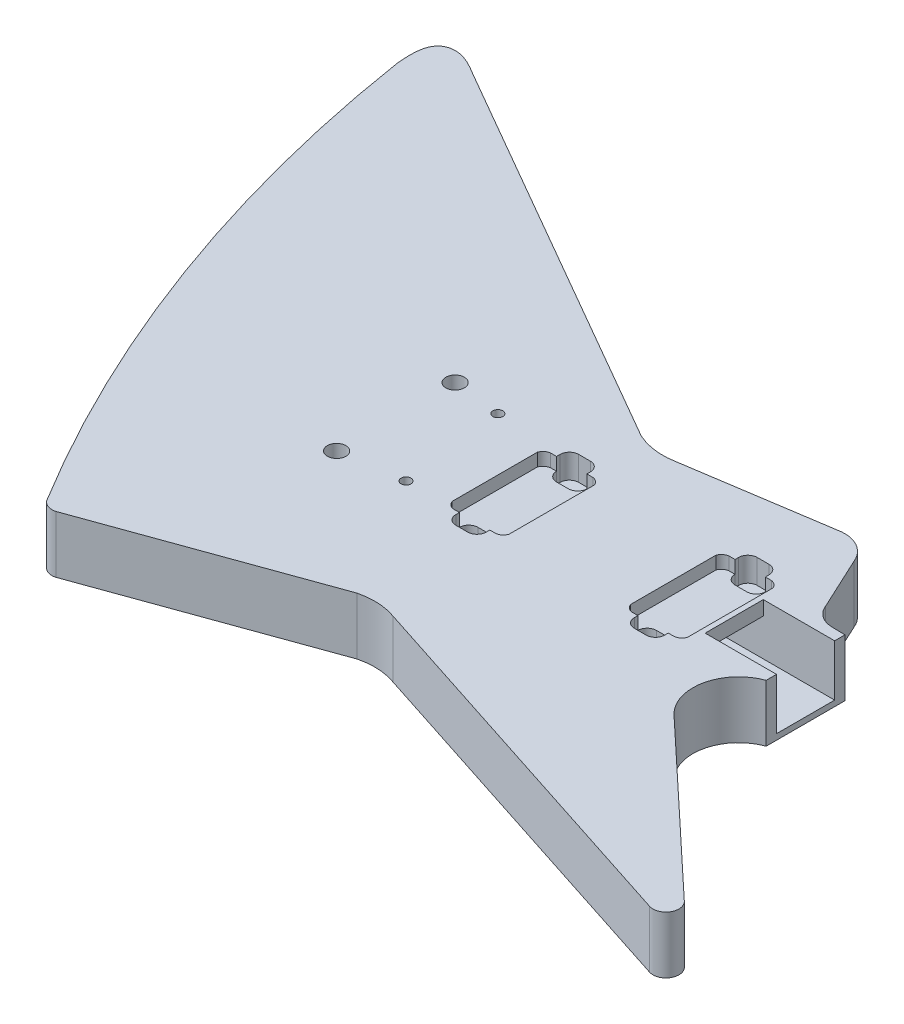
from build123d import *
from OCP.BRepAlgoAPI import BRepAlgoAPI_Cut
from OCP.TopTools import TopTools_ListOfShape
from build123d.topology import SkipClean

# Parameters (mm, degrees)
BOSS_EXTRUDE1_DEPTH            = 40
CUT_EXTRUDE1_DEPTH             = 9
CUT_EXTRUDE2_DEPTH             = 8
CUT_EXTRUDE3_DEPTH             = 9
CUT_EXTRUDE4_DEPTH             = 8
CUT_EXTRUDE5_DEPTH             = 8
CUT_EXTRUDE6_DEPTH             = 8
CUT_EXTRUDE7_DEPTH             = 40.73
F_7_0_7_DIAMETER_HOLE1_D       = 7
F_7_0_7_DIAMETER_HOLE1_DEPTH   = 29
F_13_0_13_DIAMETER_HOLE1_D     = 13
F_13_0_13_DIAMETER_HOLE1_DEPTH = 29


with BuildPart() as part:
    # Sketch1 → Boss-Extrude1 (new body)
    with BuildSketch(Plane(origin=(0, 20, 0), x_dir=(1, 0, 0), z_dir=(0, 1, 0))):
        with BuildLine():
            Line((563.96485174, 507.513718698), (563.96485174, 562.736423486))
            Line((563.96485174, 562.736423486), (554.690781869, 562.894803628))
            ThreePointArc((554.690781869, 562.894803628), (545.704943994, 565.795150829), (539.853906856, 573.206133263))
            Line((539.853906856, 573.206133263), (522.524343645, 610.429990226))
            ThreePointArc((522.524343645, 610.429990226), (512.649800976, 621.543175495), (497.931198247, 623.634159339))
            Line((497.931198247, 623.634159339), (399.830947056, 608.608698386))
            ThreePointArc((399.830947056, 608.608698386), (385.610832142, 608.137408426), (371.923585817, 612.02238853))
            Line((371.923585817, 612.02238853), (95.310746964, 771.494097008))
            add(Edge.make_bspline(
                [(60.287007155, 752.902507236), (59.408683029, 762.769524202), (58.560960325, 776.204376236), (76.94287295, 783.298520304), (86.753146937, 776.493697586), (95.310746964, 771.494097008)],
                knots=[0, 0, 0, 0, 0.5, 0.5, 1, 1, 1, 1], degree=3))
            ThreePointArc((60.287007155, 752.902507236), (112.407005996, 551.803928099), (202.762947005, 364.739937083))
            ThreePointArc((202.762947005, 364.739937083), (207.132055784, 361.391783138), (212.632195034, 361.173346422))
            Line((212.632195034, 361.173346422), (367.65464082, 417.084401042))
            ThreePointArc((367.65464082, 417.084401042), (380.966681082, 418.419109504), (394.090964942, 415.82198883))
            Line((394.090964942, 415.82198883), (660.231475403, 329.574923038))
            ThreePointArc((660.231475403, 329.574923038), (670.878462163, 333.606992627), (669.266978502, 344.877264703))
            Line((669.266978502, 344.877264703), (553.73117364, 453.239940989))
            ThreePointArc((553.73117364, 453.239940989), (543.342125743, 483.300566911), (563.96485174, 507.513718698))
        make_face()
    extrude(amount=-BOSS_EXTRUDE1_DEPTH)

    # Sketch2 → Cut-Extrude1 (cut)
    with BuildSketch(Plane(origin=(0, 20, 0), x_dir=(-1, 0, 0), z_dir=(0, 1, 0))):
        with BuildLine():
            Line((-375.961047941, -499.395283579), (-375.961047941, -501.895283579))
            Line((-375.961047941, -501.895283579), (-380.19743869, -501.895283579))
            ThreePointArc((-380.19743869, -501.895283579), (-383.334721276, -503.261242071), (-385.264615119, -506.086820662))
            Line((-385.264615119, -506.086820662), (-385.264615119, -565.732528297))
            ThreePointArc((-385.264615119, -565.732528297), (-383.334721277, -568.558106887), (-380.197438694, -569.924065379))
            Line((-380.197438694, -569.924065379), (-375.961047941, -569.924065379))
            Line((-375.961047941, -569.924065379), (-375.961047941, -572.424065379))
            ThreePointArc((-375.961047941, -572.424065379), (-374.057242019, -577.020259457), (-369.461047941, -578.924065379))
            Line((-369.461047941, -578.924065379), (-361.195765613, -578.924065379))
            ThreePointArc((-361.195765613, -578.924065379), (-356.599571535, -577.020259457), (-354.695765613, -572.424065379))
            Line((-354.695765613, -572.424065379), (-354.695765613, -569.924065379))
            Line((-354.695765613, -569.924065379), (-350.459374862, -569.924065379))
            ThreePointArc((-350.459374862, -569.924065379), (-347.322092956, -568.55810734), (-345.3922012, -565.732528296))
            Line((-345.3922012, -565.732528296), (-345.3922012, -506.086820663))
            ThreePointArc((-345.3922012, -506.086820663), (-347.322092957, -503.261241618), (-350.459374866, -501.895283579))
            Line((-350.459374866, -501.895283579), (-354.695765613, -501.895283579))
            Line((-354.695765613, -501.895283579), (-354.695765613, -499.395283579))
            ThreePointArc((-354.695765613, -499.395283579), (-356.599571535, -494.799089501), (-361.195765613, -492.895283579))
            Line((-361.195765613, -492.895283579), (-369.461047941, -492.895283579))
            ThreePointArc((-369.461047941, -492.895283579), (-374.057242019, -494.799089501), (-375.961047941, -499.395283579))
        make_face()
    extrude(amount=-CUT_EXTRUDE1_DEPTH, mode=Mode.SUBTRACT)

    # Sketch3 → Cut-Extrude2 (cut)
    with BuildSketch(Plane(origin=(0, 11, 0), x_dir=(-1, 0, 0), z_dir=(0, 1, 0))):
        with BuildLine():
            Line((-361.195765613, -492.895279984), (-369.461047941, -492.895279984))
            ThreePointArc((-369.461047941, -492.895279984), (-374.057242019, -494.799085907), (-375.961047941, -499.395279985))
            Line((-375.961047941, -499.395279985), (-375.961047941, -501.895279985))
            ThreePointArc((-375.961047941, -501.895279985), (-374.057242221, -506.491473573), (-369.461048632, -508.395279293))
            Line((-369.461048632, -508.395279293), (-361.19104863, -508.395279293))
            ThreePointArc((-361.19104863, -508.395279293), (-356.596520928, -506.491186012), (-354.695765613, -501.895276389))
            Line((-354.695765613, -501.895276389), (-354.695765613, -499.395279984))
            ThreePointArc((-354.695765613, -499.395279984), (-356.599571535, -494.799085907), (-361.195765613, -492.895279984))
        make_face()
    extrude(amount=-CUT_EXTRUDE2_DEPTH, mode=Mode.SUBTRACT)

    # Sketch4 → Cut-Extrude3 (cut)
    with BuildSketch(Plane(origin=(0, 20, 0), x_dir=(-1, 0, 0), z_dir=(0, 1, 0))):
        with BuildLine():
            Line((-479.744131485, -572.424065379), (-479.744131485, -569.924065379))
            Line((-479.744131485, -569.924065379), (-475.507740734, -569.924065379))
            ThreePointArc((-475.507740734, -569.924065379), (-472.370458828, -568.55810734), (-470.440567072, -565.732528296))
            Line((-470.440567072, -565.732528296), (-470.440567072, -506.086820663))
            ThreePointArc((-470.440567072, -506.086820663), (-472.370458829, -503.261241618), (-475.507740738, -501.895283579))
            Line((-475.507740738, -501.895283579), (-479.744131485, -501.895283579))
            Line((-479.744131485, -501.895283579), (-479.744131485, -499.395283579))
            ThreePointArc((-479.744131485, -499.395283579), (-481.647937407, -494.799089501), (-486.244131485, -492.895283579))
            Line((-486.244131485, -492.895283579), (-494.509413812, -492.895283579))
            ThreePointArc((-494.509413812, -492.895283579), (-499.10560789, -494.799089501), (-501.009413812, -499.395283579))
            Line((-501.009413812, -499.395283579), (-501.009413812, -501.895283579))
            Line((-501.009413812, -501.895283579), (-505.245804562, -501.895283579))
            ThreePointArc((-505.245804562, -501.895283579), (-508.383087148, -503.261242071), (-510.312980991, -506.086820662))
            Line((-510.312980991, -506.086820662), (-510.312980991, -565.732528297))
            ThreePointArc((-510.312980991, -565.732528297), (-508.383087149, -568.558106887), (-505.245804566, -569.924065379))
            Line((-505.245804566, -569.924065379), (-501.009413812, -569.924065379))
            Line((-501.009413812, -569.924065379), (-501.009413812, -572.424065379))
            ThreePointArc((-501.009413812, -572.424065379), (-499.10560789, -577.020259457), (-494.509413812, -578.924065379))
            Line((-494.509413812, -578.924065379), (-486.244131485, -578.924065379))
            ThreePointArc((-486.244131485, -578.924065379), (-481.647937407, -577.020259457), (-479.744131485, -572.424065379))
        make_face()
    extrude(amount=-CUT_EXTRUDE3_DEPTH, mode=Mode.SUBTRACT)

    # Sketch5 → Cut-Extrude4 (cut)
    with BuildSketch(Plane(origin=(0, 11, 0), x_dir=(-1, 0, 0), z_dir=(0, 1, 0))):
        with BuildLine():
            Line((-486.244131485, -492.895283579), (-494.509413812, -492.895283579))
            ThreePointArc((-494.509413812, -492.895283579), (-499.10560789, -494.799089501), (-501.009413812, -499.395283579))
            Line((-501.009413812, -499.395283579), (-501.009413812, -501.895283579))
            ThreePointArc((-501.009413812, -501.895283579), (-499.108657916, -506.491191283), (-494.514131485, -508.395283579))
            Line((-494.514131485, -508.395283579), (-486.244131485, -508.395283579))
            ThreePointArc((-486.244131485, -508.395283579), (-481.647937407, -506.491477657), (-479.744131485, -501.895283579))
            Line((-479.744131485, -501.895283579), (-479.744131485, -499.395283579))
            ThreePointArc((-479.744131485, -499.395283579), (-481.647937407, -494.799089501), (-486.244131485, -492.895283579))
        make_face()
    extrude(amount=-CUT_EXTRUDE4_DEPTH, mode=Mode.SUBTRACT)


with BuildPart() as cut_extrude5_tool:
    # Sketch6 → Cut-Extrude5 (new body)
    with BuildSketch(Plane(origin=(0, 11, 0), x_dir=(-1, 0, 0), z_dir=(0, 1, 0))):
        with BuildLine():
            Line((-369.461049324, -578.924068974), (-361.195766995, -578.924068974))
            ThreePointArc((-361.195766995, -578.924068974), (-356.599572918, -577.020263051), (-354.695766995, -572.424068974))
            Line((-354.695766995, -572.424068974), (-354.695766995, -569.924072568))
            ThreePointArc((-354.695766995, -569.924072568), (-356.59652231, -565.328162946), (-361.191050012, -563.424069665))
            Line((-361.191050012, -563.424069665), (-369.461050015, -563.424069665))
            ThreePointArc((-369.461050015, -563.424069665), (-374.057243604, -565.327875385), (-375.961049323, -569.924068973))
            Line((-375.961049323, -569.924068973), (-375.961049323, -572.424068974))
            ThreePointArc((-375.961049323, -572.424068974), (-374.057243401, -577.020263051), (-369.461049324, -578.924068974))
        make_face()
    extrude(amount=-CUT_EXTRUDE5_DEPTH)


with BuildPart() as part_1:
    add(part.part)

    # Cut-Extrude5: cut by cut_extrude5_tool, with a tolerance
    cut_extrude5_stock = TopTools_ListOfShape()
    cut_extrude5_stock.Append(part_1.part.wrapped)
    cut_extrude5_tools = TopTools_ListOfShape()
    cut_extrude5_tools.Append(cut_extrude5_tool.part.wrapped)
    cut_extrude5_cut = BRepAlgoAPI_Cut()
    cut_extrude5_cut.SetArguments(cut_extrude5_stock)
    cut_extrude5_cut.SetTools(cut_extrude5_tools)
    cut_extrude5_cut.SetFuzzyValue(0.00001)
    cut_extrude5_cut.Build()
    add(Compound.cast(cut_extrude5_cut.Shape()).solids(), mode=Mode.REPLACE)

    # Sketch7 → Cut-Extrude6 (cut)
    with SkipClean():  # the faces are left unmerged after this step: merging them gives an invalid solid
        with BuildSketch(Plane(origin=(0, 11, 0), x_dir=(-1, 0, 0), z_dir=(0, 1, 0))):
            with BuildLine():
                Line((-494.509413812, -578.924065379), (-486.244131485, -578.924065379))
                ThreePointArc((-486.244131485, -578.924065379), (-481.647937407, -577.020259457), (-479.744131485, -572.424065379))
                Line((-479.744131485, -572.424065379), (-479.744131485, -569.924065379))
                ThreePointArc((-479.744131485, -569.924065379), (-481.647937407, -565.327871301), (-486.244131485, -563.424065379))
                Line((-486.244131485, -563.424065379), (-494.514131485, -563.424065379))
                ThreePointArc((-494.514131485, -563.424065379), (-499.108657916, -565.328157675), (-501.009413812, -569.924065379))
                Line((-501.009413812, -569.924065379), (-501.009413812, -572.424065379))
                ThreePointArc((-501.009413812, -572.424065379), (-499.10560789, -577.020259457), (-494.509413812, -578.924065379))
            make_face()
        extrude(amount=-CUT_EXTRUDE6_DEPTH, mode=Mode.SUBTRACT)

    # Sketch8 → Cut-Extrude7 (cut)
    with SkipClean():  # the faces are left unmerged after this step: merging them gives an invalid solid
        with BuildSketch(Plane.XY.offset(-514.76642324)):
            Polygon((463.964851744, -16), (563.964851744, -16), (563.964851744, 20), (513.964851744, 20), (513.964851744, 10), (463.964851744, 10), align=None)
        extrude(amount=-CUT_EXTRUDE7_DEPTH, mode=Mode.SUBTRACT)

    # Ø7.0 (7) Diameter Hole1
    with Locations(Plane(origin=(0, 20, 0), x_dir=(1, 0, 0), z_dir=(0, 1, 0))):
        with Locations((308.179113698, 575.311111117), (316.876935056, 502.297353485)):
            Hole(F_7_0_7_DIAMETER_HOLE1_D / 2, depth=F_7_0_7_DIAMETER_HOLE1_DEPTH)

    # Ø13.0 (13) Diameter Hole1
    with Locations(Plane(origin=(0, 20, 0), x_dir=(1, 0, 0), z_dir=(0, 1, 0))):
        with Locations((274.335910331, 496.233480955), (274.335910331, 579.213058938)):
            Hole(F_13_0_13_DIAMETER_HOLE1_D / 2, depth=F_13_0_13_DIAMETER_HOLE1_DEPTH)


solid = part_1.part
